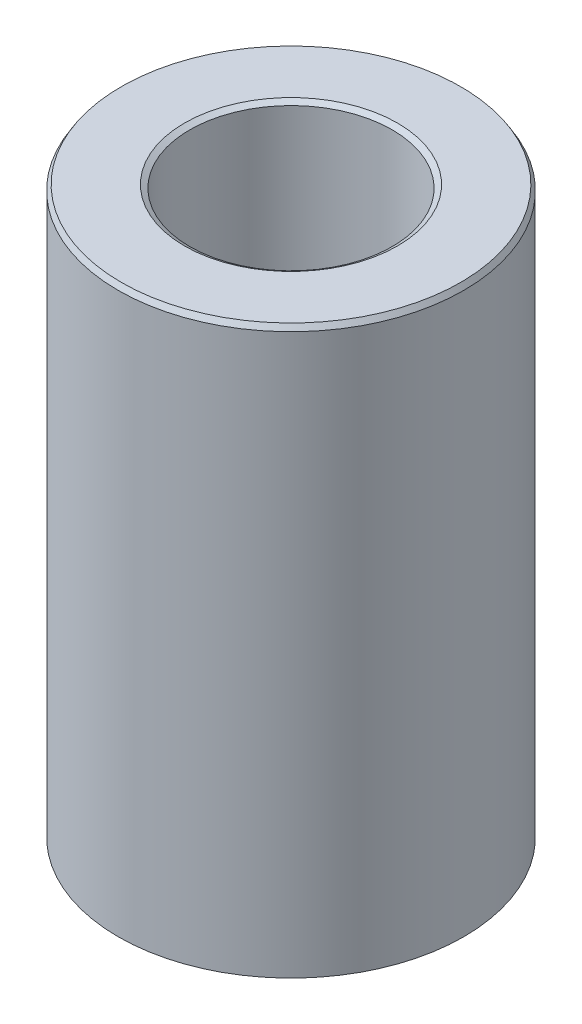
from build123d import *
from OCP.BRepFilletAPI import BRepFilletAPI_MakeChamfer

# Parameters (mm, degrees)
SKETCH1_R           = 60
BOSS_EXTRUDE1_DEPTH = 197.273751037
SKETCH2_R           = 35.138934198
CUT_EXTRUDE1_DEPTH  = 215.748533984
CHAMFER1_SIZE       = 1.831656242
CHAMFER1_SIZE2      = 1.110139071


with BuildPart() as part:
    # Sketch1 → Boss-Extrude1 (new body)
    with BuildSketch(Plane(origin=(0, 0, 0), x_dir=(1, 0, 0), z_dir=(0, 1, 0))):
        Circle(SKETCH1_R)
    extrude(amount=BOSS_EXTRUDE1_DEPTH)

    # Sketch2 → Cut-Extrude1 (cut, through all)
    with BuildSketch(Plane(origin=(0, 0, 0), x_dir=(1, 0, 0), z_dir=(0, 1, 0))):
        Circle(SKETCH2_R)
    extrude(amount=CUT_EXTRUDE1_DEPTH, mode=Mode.SUBTRACT)

    # Chamfer1: one chamfer whose edges measure the first distance from different faces: ONE call of the kernel's chamfer builder (chamfer() names one face for all edges)
    chamfer1_edges_1 = [part.edges().sort_by_distance(p)[0] for p in [
        (-35.138934198, 197.273751037, 0),
    ]]
    chamfer1_side_1 = [part.faces().sort_by_distance(p)[0] for p in [
        (-58.302943725, 197.273751037, 0),
    ]]
    chamfer1_edges_2 = [part.edges().sort_by_distance(p)[0] for p in [
        (-35.138934198, 0, 0),
    ]]
    chamfer1_side_2 = [part.faces().sort_by_distance(p)[0] for p in [
        (-35.138934198, 98.636875519, 0),
    ]]
    chamfer1_edges_3 = [part.edges().sort_by_distance(p)[0] for p in [
        (-60, 0, 0),
    ]]
    chamfer1_side_3 = [part.faces().sort_by_distance(p)[0] for p in [
        (-58.302943725, 0, 0),
    ]]
    chamfer1_edges_4 = [part.edges().sort_by_distance(p)[0] for p in [
        (-60, 197.273751037, 0),
    ]]
    chamfer1_side_4 = [part.faces().sort_by_distance(p)[0] for p in [
        (-60, 98.636875519, 0),
    ]]
    chamfer1 = BRepFilletAPI_MakeChamfer(part.part.solid().wrapped)
    for e in chamfer1_edges_1:
        chamfer1.Add(CHAMFER1_SIZE, CHAMFER1_SIZE2, e.wrapped, chamfer1_side_1[0].wrapped)  # the first distance lies on this face
    for e in chamfer1_edges_2:
        chamfer1.Add(CHAMFER1_SIZE, CHAMFER1_SIZE2, e.wrapped, chamfer1_side_2[0].wrapped)  # the first distance lies on this face
    for e in chamfer1_edges_3:
        chamfer1.Add(CHAMFER1_SIZE, CHAMFER1_SIZE2, e.wrapped, chamfer1_side_3[0].wrapped)  # the first distance lies on this face
    for e in chamfer1_edges_4:
        chamfer1.Add(CHAMFER1_SIZE, CHAMFER1_SIZE2, e.wrapped, chamfer1_side_4[0].wrapped)  # the first distance lies on this face
    add(Compound.cast(chamfer1.Shape()), mode=Mode.REPLACE)


solid = part.part
